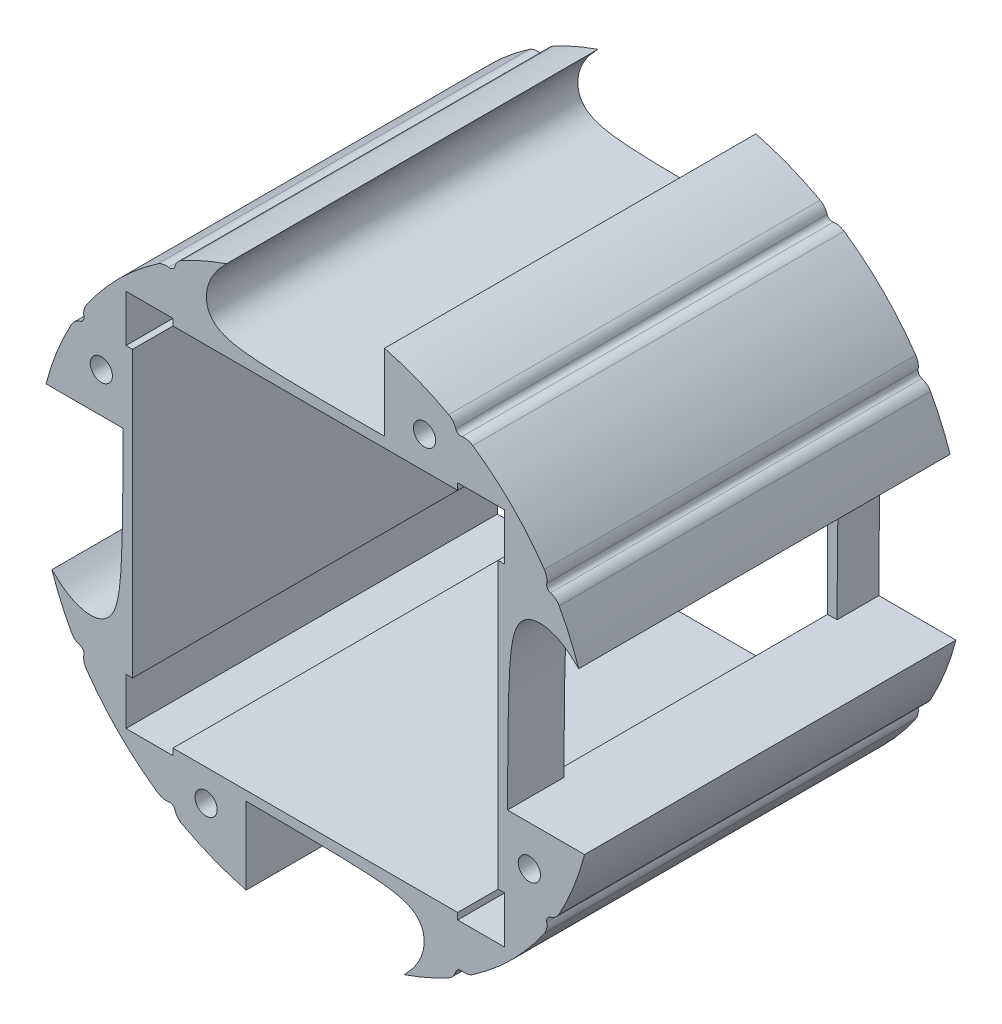
from build123d import *

# Parameters (mm, degrees)
BOSS_EXTRUDE3_OUTLINE_R = 3
BOSS_EXTRUDE3_DEPTH     = 102
CUT_EXTRUDE1_DEPTH      = 102
CUT_EXTRUDE2_DEPTH      = 102
SKETCH4_W               = 0.4
SKETCH4_H               = 1.8
SKETCH4_W_2             = 1.8
SKETCH4_H_2             = 0.4
BOSS_EXTRUDE4_DEPTH     = 102
SKETCH5_W               = 75
SKETCH5_H               = 43.392810524
CUT_EXTRUDE6_DEPTH      = 10
SKETCH7_R               = 3.05
CUT_EXTRUDE9_DEPTH      = 147.084376475
CUT_EXTRUDE8_START      = -102
CUT_EXTRUDE8_DEPTH      = 102
FILLET1_R               = 4


# Read off the part's stored shape, not the designer's step: Boss-Extrude3
with BuildPart() as part:
    # Boss-Extrude3 outline → Boss-Extrude3 (new body)
    with BuildSketch(Plane.XY):
        with BuildLine():
            add(Edge.make_bspline(
                [(24.392810524, -72.348554199), (27.040667073, -69.541086329), (29.089162938, -67.428574969), (30.241441862, -64.355831171), (31.073643307, -60.963009895), (30.561519341, -59.042545022), (29.217193929, -56.673971678), (27.488775543, -54.241382838), (25.105954954, -53), (17.37432721, -53), (-19, -52.782560411)],
                knots=[0, 0, 0, 0, 0, 0, 0, 0, 0, 0, 0, 1, 1, 1, 1, 1, 1, 1, 1, 1, 1, 1], degree=10))
            ThreePointArc((24.392810524, -72.348554199), (55.939709188, -51.962211615), (73.948106805, -19))
            Line((73.948106805, -19), (52.782560411, -19))
            add(Edge.make_bspline(
                [(72.348554199, 24.392810524), (69.541086329, 27.040667073), (67.428574969, 29.089162938), (64.355831171, 30.241441862), (60.963009895, 31.073643307), (59.042545022, 30.561519341), (56.673971678, 29.217193929), (54.241382838, 27.488775543), (53, 25.105954954), (53, 17.37432721), (52.782560411, -19)],
                knots=[0, 0, 0, 0, 0, 0, 0, 0, 0, 0, 0, 1, 1, 1, 1, 1, 1, 1, 1, 1, 1, 1], degree=10))
            ThreePointArc((72.348554199, 24.392810524), (51.962211615, 55.939709188), (19, 73.948106805))
            Line((19, 73.948106805), (19, 53))
            add(Edge.make_bspline(
                [(-24.392810524, 72.348554199), (-27.040667073, 69.541086329), (-29.089162938, 67.428574969), (-30.241441862, 64.355831171), (-31.073643307, 60.963009895), (-30.561519341, 59.042545022), (-29.217193929, 56.673971678), (-27.488775543, 54.241382838), (-25.105954954, 53), (-17.37432721, 53), (19, 53)],
                knots=[0, 0, 0, 0, 0, 0, 0, 0, 0, 0, 0, 1, 1, 1, 1, 1, 1, 1, 1, 1, 1, 1], degree=10))
            ThreePointArc((-24.392810524, 72.348554199), (-55.939709188, 51.962211615), (-73.948106805, 19))
            Line((-73.948106805, 19), (-52.782560411, 19))
            add(Edge.make_bspline(
                [(-72.348554199, -24.392810524), (-69.541086329, -27.040667073), (-67.428574969, -29.089162938), (-64.355831171, -30.241441862), (-60.963009895, -31.073643307), (-59.042545022, -30.561519341), (-56.673971678, -29.217193929), (-54.241382838, -27.488775543), (-53, -25.105954954), (-53, -17.37432721), (-52.782560411, 19)],
                knots=[0, 0, 0, 0, 0, 0, 0, 0, 0, 0, 0, 1, 1, 1, 1, 1, 1, 1, 1, 1, 1, 1], degree=10))
            ThreePointArc((-72.348554199, -24.392810524), (-51.962211615, -55.939709188), (-19, -73.948106805))
            Line((-19, -73.948106805), (-19, -52.782560411))
        make_face()
        with Locations((-30, -58.782560411)):
            Circle(BOSS_EXTRUDE3_OUTLINE_R, mode=Mode.SUBTRACT)
        with Locations((58.782560411, -30)):
            Circle(BOSS_EXTRUDE3_OUTLINE_R, mode=Mode.SUBTRACT)
        with Locations((-58.782560411, 30)):
            Circle(BOSS_EXTRUDE3_OUTLINE_R, mode=Mode.SUBTRACT)
        Polygon((-38.9, -51.6), (-51.6, -51.6), (-51.6, -38.9), (-50, -38.9), (-50, 38.9), (-51.6, 38.9), (-51.6, 51.6), (-38.9, 51.6), (-38.9, 50), (38.9, 50), (38.9, 51.6), (51.6, 51.6), (51.6, 38.9), (50, 38.9), (50, -38.9), (51.6, -38.9), (51.6, -51.6), (38.9, -51.6), (38.9, -50), (-38.9, -50), align=None, mode=Mode.SUBTRACT)
        with Locations((30, 59)):
            Circle(BOSS_EXTRUDE3_OUTLINE_R, mode=Mode.SUBTRACT)
    extrude(amount=BOSS_EXTRUDE3_DEPTH)

    # Sketch2 → Cut-Extrude1 (cut)
    with BuildSketch(Plane.XY.offset(102)):
        Polygon((51.8, -38.7), (50.2, -38.7), (50.2, 38.7), (51.8, 38.7), (51.8, 51.8), (38.7, 51.8), (38.7, 50.2), (-38.7, 50.2), (-38.7, 51.8), (-51.8, 51.8), (-51.8, 38.7), (-50.2, 38.7), (-50.2, -38.7), (-51.8, -38.7), (-51.8, -51.8), (-38.7, -51.8), (-38.7, -50.2), (38.7, -50.2), (38.7, -51.8), (51.8, -51.8), align=None)
        Polygon((51.6, -38.9), (50, -38.9), (50, 38.9), (51.6, 38.9), (51.6, 51.6), (38.9, 51.6), (38.9, 50), (-38.9, 50), (-38.9, 51.6), (-51.6, 51.6), (-51.6, 38.9), (-50, 38.9), (-50, -38.9), (-51.6, -38.9), (-51.6, -51.6), (-38.9, -51.6), (-38.9, -50), (38.9, -50), (38.9, -51.6), (51.6, -51.6), align=None, mode=Mode.SUBTRACT)
    extrude(amount=-CUT_EXTRUDE1_DEPTH, mode=Mode.SUBTRACT)

    # Sketch3 → Cut-Extrude2 (cut)
    with BuildSketch(Plane.XY.offset(102)):
        Polygon((-51.8, -51.8), (-38.7, -51.8), (-38.7, -52), (-52, -52), (-52, -38.7), (-51.8, -38.7), align=None)
        Polygon((38.7, -51.8), (51.8, -51.8), (51.8, -38.7), (52, -38.7), (52, -52), (38.7, -52), align=None)
        Polygon((51.8, 38.7), (51.8, 51.8), (38.7, 51.8), (38.7, 52), (52, 52), (52, 38.7), align=None)
        Polygon((-51.8, 51.8), (-51.8, 38.7), (-52, 38.7), (-52, 52), (-38.7, 52), (-38.7, 51.8), align=None)
    extrude(amount=-CUT_EXTRUDE2_DEPTH, mode=Mode.SUBTRACT)

    # Sketch4 → Boss-Extrude4 (add)
    with BuildSketch(Plane.XY.offset(102)):
        with Locations((-38.9, 51.1)):
            Rectangle(SKETCH4_W, SKETCH4_H)
        with Locations((-51.1, 38.9)):
            Rectangle(SKETCH4_W_2, SKETCH4_H_2)
        with Locations((38.9, 51.1)):
            Rectangle(SKETCH4_W, SKETCH4_H)
        with Locations((51.1, 38.9)):
            Rectangle(SKETCH4_W_2, SKETCH4_H_2)
        with Locations((38.9, -51.1)):
            Rectangle(SKETCH4_W, SKETCH4_H)
        with Locations((51.1, -38.9)):
            Rectangle(SKETCH4_W_2, SKETCH4_H_2)
        with Locations((-51.1, -38.9)):
            Rectangle(SKETCH4_W_2, SKETCH4_H_2)
        with Locations((-38.9, -51.1)):
            Rectangle(SKETCH4_W, SKETCH4_H)
    extrude(amount=-BOSS_EXTRUDE4_DEPTH)

    # Sketch5 → Cut-Extrude6 (cut)
    with BuildSketch(Plane.ZY.offset(-50.2)):
        with Locations((49, 2.696405262)):
            Rectangle(SKETCH5_W, SKETCH5_H)
    extrude(amount=-CUT_EXTRUDE6_DEPTH, mode=Mode.SUBTRACT)

    # Sketch7 → Cut-Extrude9 (cut, through all)
    with BuildSketch(Plane(origin=(0, 0, 0), x_dir=(-1, 0, 0), z_dir=(0, 0, -1))):
        with Locations((30, -58.782560411)):
            Circle(SKETCH7_R)
        with Locations((-58.782560411, -30)):
            Circle(SKETCH7_R)
        with Locations((58.782560411, 30)):
            Circle(SKETCH7_R)
        with Locations((-30, 59)):
            Circle(SKETCH7_R)
    extrude(amount=-CUT_EXTRUDE9_DEPTH, mode=Mode.SUBTRACT)

    # Sketch6 → Cut-Extrude8 (cut)
    with BuildSketch(Plane.XY.offset(102).offset(CUT_EXTRUDE8_START)):
        with BuildLine():
            ThreePointArc((-65.806507446, 38.714675225), (-63.755574673, 39.214145383), (-64.234874045, 41.269885588))
            ThreePointArc((-64.234874045, 41.269885588), (-65.0332415, 40), (-65.806507446, 38.714675225))
        make_face()
        with BuildLine():
            ThreePointArc((-38.714675225, 65.806507446), (-40, 65.0332415), (-41.269885588, 64.234874045))
            ThreePointArc((-41.269885588, 64.234874045), (-39.214145383, 63.755574673), (-38.714675225, 65.806507446))
        make_face()
        with BuildLine():
            ThreePointArc((41.269885588, 64.234874045), (40, 65.0332415), (38.714675225, 65.806507446))
            ThreePointArc((38.714675225, 65.806507446), (39.214145383, 63.755574673), (41.269885588, 64.234874045))
        make_face()
        with BuildLine():
            ThreePointArc((65.806507446, 38.714675225), (65.0332415, 40), (64.234874045, 41.269885588))
            ThreePointArc((64.234874045, 41.269885588), (63.755574673, 39.214145383), (65.806507446, 38.714675225))
        make_face()
        with BuildLine():
            ThreePointArc((65.806507446, -38.714675225), (63.755574673, -39.214145383), (64.234874045, -41.269885588))
            ThreePointArc((64.234874045, -41.269885588), (65.0332415, -40), (65.806507446, -38.714675225))
        make_face()
        with BuildLine():
            ThreePointArc((38.714675225, -65.806507446), (40, -65.0332415), (41.269885588, -64.234874045))
            ThreePointArc((41.269885588, -64.234874045), (39.214145383, -63.755574673), (38.714675225, -65.806507446))
        make_face()
        with BuildLine():
            ThreePointArc((-38.714675225, -65.806507446), (-39.214145383, -63.755574673), (-41.269885588, -64.234874045))
            ThreePointArc((-41.269885588, -64.234874045), (-40, -65.0332415), (-38.714675225, -65.806507446))
        make_face()
        with BuildLine():
            ThreePointArc((-65.806507446, -38.714675225), (-65.0332415, -40), (-64.234874045, -41.269885588))
            ThreePointArc((-64.234874045, -41.269885588), (-63.755574673, -39.214145383), (-65.806507446, -38.714675225))
        make_face()
    extrude(amount=CUT_EXTRUDE8_DEPTH, mode=Mode.SUBTRACT)

    # Fillet1
    fillet1_edges = [part.edges().sort_by_distance(p)[0] for p in [
        (-41.269885588, 64.234874045, 51),
        (-38.714675225, 65.806507446, 51),
        (41.269885588, 64.234874045, 51),
        (38.714675225, 65.806507446, 51),
        (64.234874045, 41.269885588, 51),
        (65.806507446, 38.714675225, 51),
        (64.234874045, -41.269885588, 51),
        (65.806507446, -38.714675225, 51),
        (41.269885588, -64.234874045, 51),
        (38.714675225, -65.806507446, 51),
        (-41.269885588, -64.234874045, 51),
        (-38.714675225, -65.806507446, 51),
        (-64.234874045, -41.269885588, 51),
        (-65.806507446, -38.714675225, 51),
        (-64.234874045, 41.269885588, 51),
        (-65.806507446, 38.714675225, 51),
    ]]
    fillet(fillet1_edges, radius=FILLET1_R)


solid = part.part
